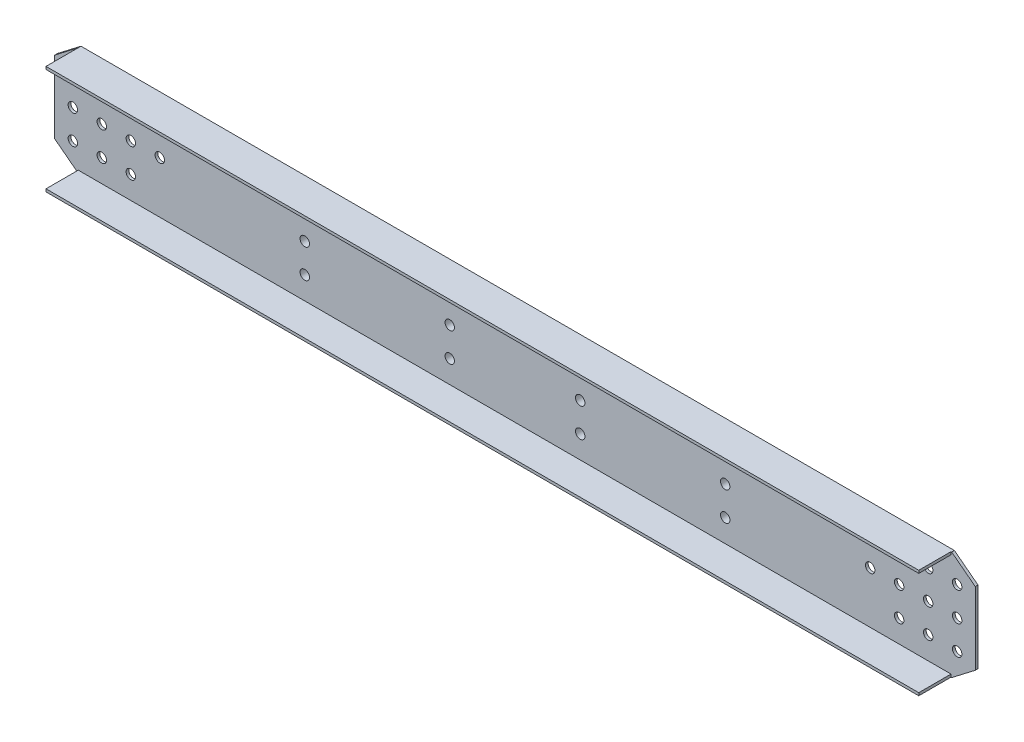
from build123d import *

# Parameters (mm, degrees)
SKETCH_1_R          = 13
EXTRUDE_634_DEPTH   = 7.5
SKETCH_2_W          = 2408.049034164
SKETCH_2_H          = 7.5
EXTRUDE_1_DEPTH     = 89
SKETCH_3_W          = 80
SKETCH_3_H          = 240
EXTRUDE_2_DEPTH     = 16
SKETCH_4_R          = 13
CUT_EXTRUDE_1_DEPTH = 1308.983562588


with BuildPart() as part:
    # 草图1 → Extrude 634 (new body)
    with BuildSketch(Plane.XY):
        Polygon((-1205, 0), (1205, 0), (1270, 50), (1270, 250), (1205, 300), (-1205, 300), (-1270, 250), (-1270, 50), align=None)
        with Locations((-1220, 230)):
            Circle(SKETCH_1_R, mode=Mode.SUBTRACT)
        with Locations((-1220, 150)):
            Circle(SKETCH_1_R, mode=Mode.SUBTRACT)
        with Locations((-1140, 230)):
            Circle(SKETCH_1_R, mode=Mode.SUBTRACT)
        with Locations((-1140, 150)):
            Circle(SKETCH_1_R, mode=Mode.SUBTRACT)
        with Locations((-1060, 230)):
            Circle(SKETCH_1_R, mode=Mode.SUBTRACT)
        with Locations((-1060, 150)):
            Circle(SKETCH_1_R, mode=Mode.SUBTRACT)
        with Locations((-980, 150)):
            Circle(SKETCH_1_R, mode=Mode.SUBTRACT)
        with Locations((-1060, 70)):
            Circle(SKETCH_1_R, mode=Mode.SUBTRACT)
        with Locations((-1140, 70)):
            Circle(SKETCH_1_R, mode=Mode.SUBTRACT)
        with Locations((-1220, 70)):
            Circle(SKETCH_1_R, mode=Mode.SUBTRACT)
        with Locations((1220, 70)):
            Circle(SKETCH_1_R, mode=Mode.SUBTRACT)
        with Locations((1140, 70)):
            Circle(SKETCH_1_R, mode=Mode.SUBTRACT)
        with Locations((1060, 70)):
            Circle(SKETCH_1_R, mode=Mode.SUBTRACT)
        with Locations((980, 150)):
            Circle(SKETCH_1_R, mode=Mode.SUBTRACT)
        with Locations((1060, 150)):
            Circle(SKETCH_1_R, mode=Mode.SUBTRACT)
        with Locations((1060, 230)):
            Circle(SKETCH_1_R, mode=Mode.SUBTRACT)
        with Locations((1140, 150)):
            Circle(SKETCH_1_R, mode=Mode.SUBTRACT)
        with Locations((1140, 230)):
            Circle(SKETCH_1_R, mode=Mode.SUBTRACT)
        with Locations((1220, 150)):
            Circle(SKETCH_1_R, mode=Mode.SUBTRACT)
        with Locations((1220, 230)):
            Circle(SKETCH_1_R, mode=Mode.SUBTRACT)
    extrude(amount=-EXTRUDE_634_DEPTH)

    # 草图2 → 凸台-拉伸1 (add)
    with BuildSketch(Plane.XY):
        with Locations((-0.975482918, 296.25)):
            Rectangle(SKETCH_2_W, SKETCH_2_H)
        with Locations((-0.975482918, 3.75)):
            Rectangle(SKETCH_2_W, SKETCH_2_H)
    extrude(amount=EXTRUDE_1_DEPTH)

    # 草图3 → 凸台-拉伸2 (add)
    with BuildSketch(Plane(origin=(0, 0, -7.5), x_dir=(-1, 0, 0), z_dir=(0, 0, -1))):
        with Locations((-580, 150)):
            Rectangle(SKETCH_3_W, SKETCH_3_H)
        with Locations((-180, 150)):
            Rectangle(SKETCH_3_W, SKETCH_3_H)
        with Locations((180, 150)):
            Rectangle(SKETCH_3_W, SKETCH_3_H)
        with Locations((580, 150)):
            Rectangle(SKETCH_3_W, SKETCH_3_H)
    extrude(amount=EXTRUDE_2_DEPTH)

    # 草图4 → 切除-拉伸1 (cut, through all)
    with BuildSketch(Plane.XY):
        with Locations((-580, 230)):
            Circle(SKETCH_4_R)
        with Locations((-580, 150)):
            Circle(SKETCH_4_R)
        with Locations((-180, 230)):
            Circle(SKETCH_4_R)
        with Locations((-180, 150)):
            Circle(SKETCH_4_R)
        with Locations((-180, 70)):
            Circle(SKETCH_4_R)
        with Locations((-580, 70)):
            Circle(SKETCH_4_R)
        with Locations((580, 70)):
            Circle(SKETCH_4_R)
        with Locations((180, 70)):
            Circle(SKETCH_4_R)
        with Locations((180, 150)):
            Circle(SKETCH_4_R)
        with Locations((180, 230)):
            Circle(SKETCH_4_R)
        with Locations((580, 150)):
            Circle(SKETCH_4_R)
        with Locations((580, 230)):
            Circle(SKETCH_4_R)
    extrude(amount=-CUT_EXTRUDE_1_DEPTH, mode=Mode.SUBTRACT)


solid = part.part
